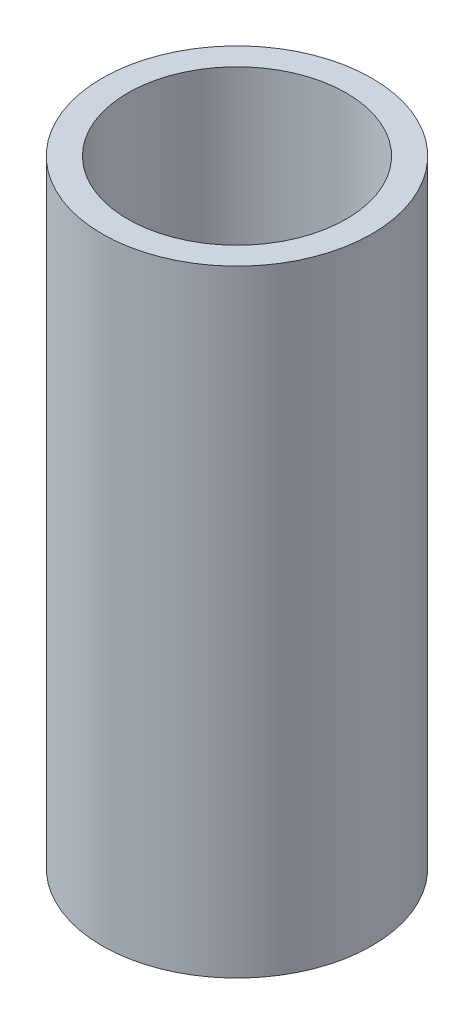
from build123d import *

# Parameters (mm, degrees)
SKETCH1_R           = 25
BOSS_EXTRUDE1_DEPTH = 114.271054172
SKETCH2_R           = 20.257788323
CUT_EXTRUDE1_DEPTH  = 120.615525002


with BuildPart() as part:
    # Sketch1 → Boss-Extrude1 (new body)
    with BuildSketch(Plane(origin=(0, 0, 0), x_dir=(1, 0, 0), z_dir=(0, 1, 0))):
        Circle(SKETCH1_R)
    extrude(amount=BOSS_EXTRUDE1_DEPTH)

    # Sketch2 → Cut-Extrude1 (cut, through all)
    with BuildSketch(Plane(origin=(0, 0, 0), x_dir=(1, 0, 0), z_dir=(0, 1, 0))):
        Circle(SKETCH2_R)
    extrude(amount=CUT_EXTRUDE1_DEPTH, mode=Mode.SUBTRACT)


solid = part.part
